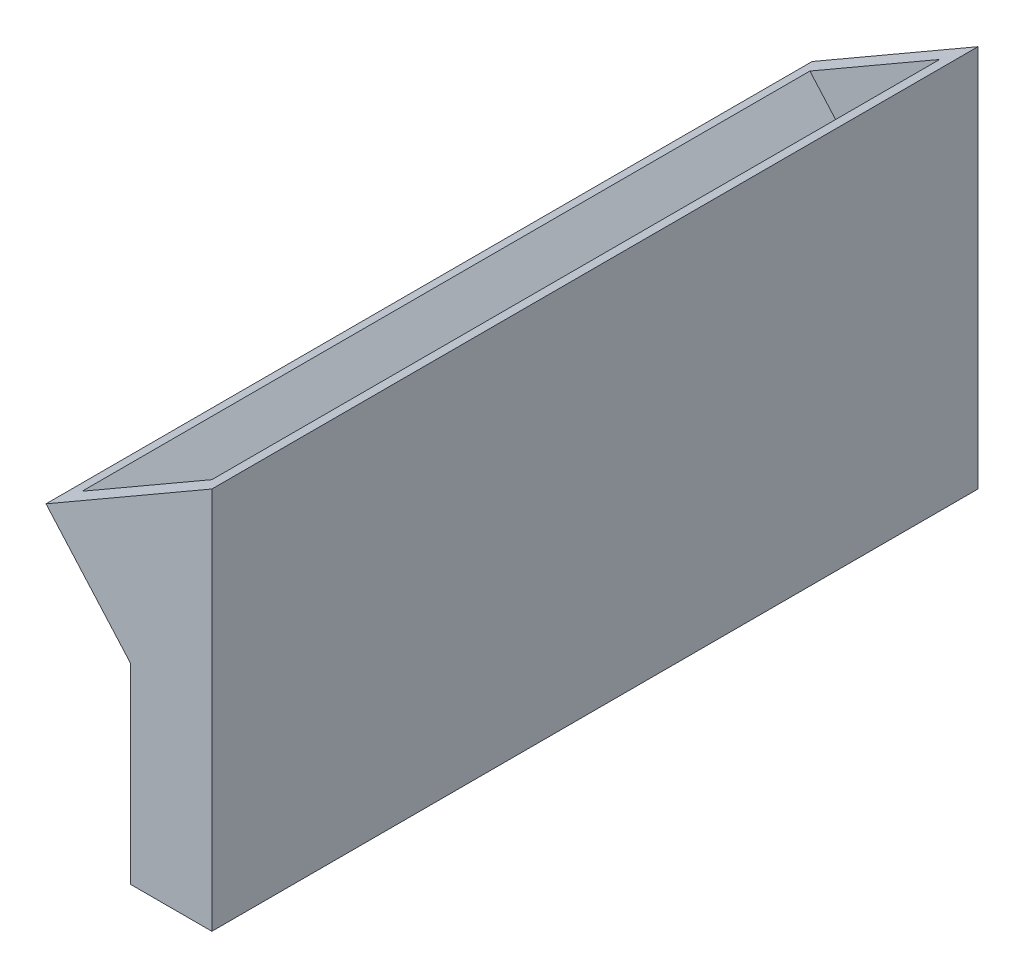
from build123d import *

# Parameters (mm, degrees)
BOSS_EXTRUDE1_DEPTH = 600
SHELL1_T            = -30
SKETCH3_W           = 67.520055582
SKETCH3_H           = 1140
CUT_EXTRUDE1_DEPTH  = 806.232885568
BOSS_EXTRUDE2_DEPTH = 127.52006
SHELL2_START        = -97.520055582
SHELL2_DEPTH        = 67.520055582
SKETCH5_W           = 67.520055582
SKETCH5_H           = 392.613662462
CUT_EXTRUDE2_DEPTH  = 868.409937688
BOSS_EXTRUDE3_DEPTH = 127.520055582
FILLET1_R           = 40


# Read off the part's stored shape, not the designer's step: Shell2
with BuildPart() as part:
    # Sketch2 → Boss-Extrude1 (new, symmetric)
    with BuildSketch(Plane.XY):
        Polygon((0, 0), (0, 500), (-259.807621135, 350), (-127.520055582, 200), (-127.520055582, 0), align=None)
    extrude(amount=BOSS_EXTRUDE1_DEPTH, both=True)

    # Shell1
    shell1_openings = [part.faces().sort_by_distance(p)[0] for p in [
        (-129.903810568, 425, 0),
    ]]
    offset(amount=SHELL1_T, openings=shell1_openings, kind=Kind.INTERSECTION)

    # Sketch3 → Cut-Extrude1 (cut, through all)
    with BuildSketch(Plane(origin=(0, 30, 0), x_dir=(1, 0, 0), z_dir=(0, 1, 0))):
        with Locations((-63.760027791, 0)):
            Rectangle(SKETCH3_W, SKETCH3_H)
    extrude(amount=-CUT_EXTRUDE1_DEPTH, mode=Mode.SUBTRACT)

    # Sketch4 → Boss-Extrude2 (add)
    with BuildSketch(Plane(origin=(0, 0, 0), x_dir=(0, 0, -1), z_dir=(1, 0, 0))):
        Polygon((-600, 0), (600, 0), (200, -100), (-200, -100), align=None)
    extrude(amount=-BOSS_EXTRUDE2_DEPTH)

    # Shell2 outline → Shell2 (cut)
    with BuildSketch(Plane.YZ.offset(SHELL2_START)):
        Polygon((0, -476.306831231), (0, 476.306831231), (-70, 196.306831231), (-70, -196.306831231), align=None)
    extrude(amount=SHELL2_DEPTH, mode=Mode.SUBTRACT)

    # Sketch5 → Cut-Extrude2 (cut, through all)
    with BuildSketch(Plane(origin=(0, -70, 0), x_dir=(1, 0, 0), z_dir=(0, 1, 0))):
        with Locations((-63.760027791, 0)):
            Rectangle(SKETCH5_W, SKETCH5_H)
    extrude(amount=-CUT_EXTRUDE2_DEPTH, mode=Mode.SUBTRACT)

    # Sketch6 → Boss-Extrude3 (add)
    with BuildSketch(Plane(origin=(0, 0, -600), x_dir=(0, 0, -1), z_dir=(1, 0, 0))):
        Polygon((-1200, 0), (-800, -100), (-1200, -100), align=None)
        Polygon((-400, -100), (0, 0), (0, -100), align=None)
    extrude(amount=-BOSS_EXTRUDE3_DEPTH)

    # Fillet1
    # the kernel refuses this fillet: 40 mm, written as the material it takes off along each edge
    with BuildSketch(Plane(origin=(-97.520055582, -70, 196.306831231), x_dir=(0, 0.24253562503633297, 0.9701425001453319), z_dir=(1, 0, 0))) as fillet1_piece_1:
        with BuildLine():
            CenterArc((31.211373056, 40), FILLET1_R, 195.806721483, 74.193278517)
            Line((-7.276068751, 29.104275004), (0, 0))
            Line((0, 0), (31.211373056, 0))
        make_face()
    extrude(amount=67.520055582, mode=Mode.SUBTRACT)
    with BuildSketch(Plane(origin=(-97.520055582, -70, -196.306831231), x_dir=(0, 0.24253562503633297, -0.9701425001453319), z_dir=(1, 0, 0))) as fillet1_piece_2:
        with BuildLine():
            CenterArc((31.211373056, -40), FILLET1_R, 90, 74.193278517)
            Line((-7.276068751, -29.104275004), (0, 0))
            Line((0, 0), (31.211373056, 0))
        make_face()
    extrude(amount=67.520055582, mode=Mode.SUBTRACT)


solid = part.part
